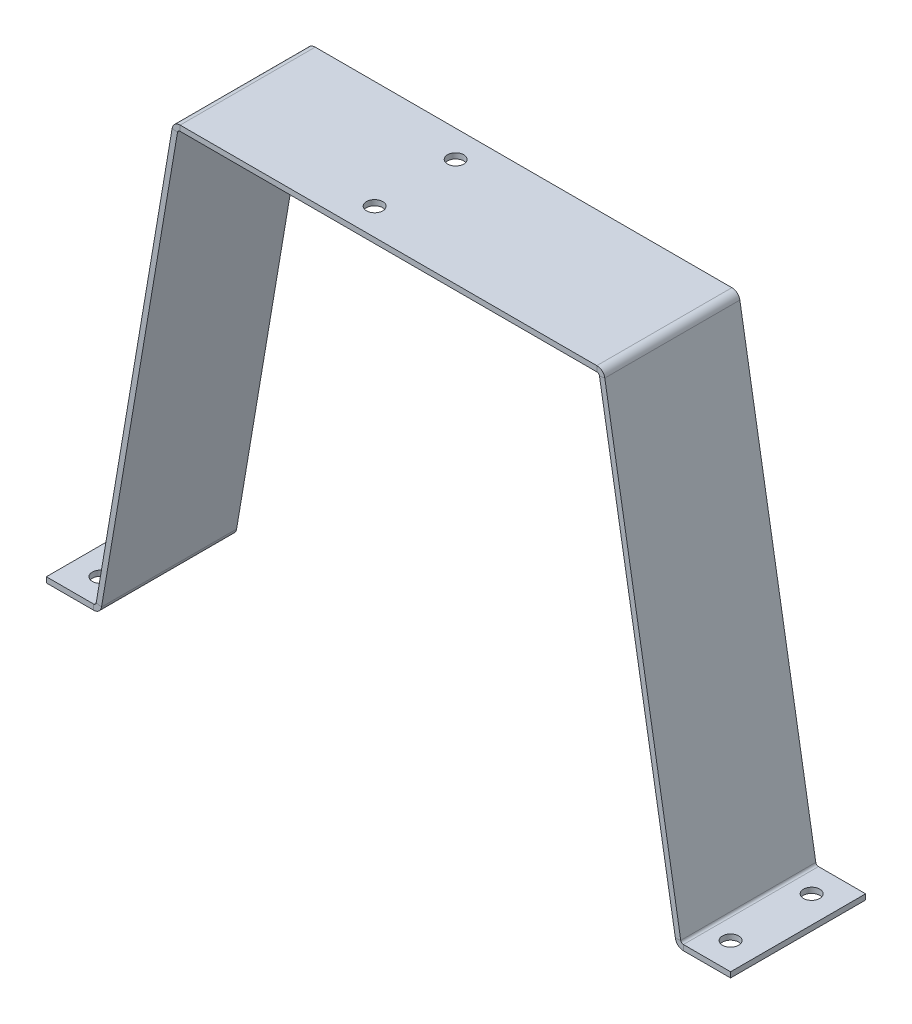
from build123d import *

# Parameters (mm, degrees)
SKETCH_1_W               = 80
SKETCH_1_H               = 25
EXTRUDE_1_DEPTH          = 1
SM_START                 = -12.5
SM_EDGE_FLANGE_1_DEPTH   = 25
SM_EDGE_FLANGE_1_2_DEPTH = 25
SM_EDGE_FLANGE_2_DEPTH   = 25
SM_EDGE_FLANGE_2_2_DEPTH = 25
SKETCH_18_R              = 1.5
CUT_EXTRUDE_1_DEPTH      = 1
SKETCH_19_R              = 1.5
CUT_EXTRUDE_2_DEPTH      = 1


# Read off the part's stored shape, not the designer's step: Ребро-кромка1, Ребро-кромка2
with BuildPart() as part:
    # Sketch 1 → Бобышка-Вытянуть1 (new body)
    with BuildSketch(Plane(origin=(0, 0, 0), x_dir=(1, 0, 0), z_dir=(0, 1, 0))):
        Rectangle(SKETCH_1_W, SKETCH_1_H)
    extrude(amount=EXTRUDE_1_DEPTH)

    # Ребро-кромка1 outline → Ребро-кромка1 (cut)
    with BuildSketch(Plane.XY.offset(SM_START)):
        with BuildLine():
            Line((-40, 0), (-39.977477944, 0))
            ThreePointArc((-39.977477944, 0), (-39.429289785, 0.724744872), (-38.563264381, 1))
            Line((-38.563264381, 1), (-40, 1))
            Line((-40, 1), (-40, 0))
        make_face()
        with BuildLine():
            Line((40, 1), (38.563264381, 1))
            ThreePointArc((38.563264381, 1), (39.429289785, 0.724744872), (39.977477944, 0))
            Line((39.977477944, 0), (40, 0))
            Line((40, 0), (40, 1))
        make_face()
    extrude(amount=SM_EDGE_FLANGE_1_DEPTH, mode=Mode.SUBTRACT)

    # Sm Edge Flange 1 2 outline → Sm Edge Flange 1 2 (add)
    with BuildSketch(Plane.XY.offset(SM_START)):
        with BuildLine():
            ThreePointArc((-39.977477944, 0), (-40.015252138, -0.123527486), (-40.042258437, -0.24984688))
            Line((-40.042258437, -0.24984688), (-54.339743625, -84.781655225))
            Line((-54.339743625, -84.781655225), (-53.353747587, -84.948423972))
            Line((-53.353747587, -84.948423972), (-39.0562624, -0.416615627))
            ThreePointArc((-39.0562624, -0.416615627), (-38.885993225, -0.118101986), (-38.563264381, 0))
            Line((-38.563264381, 0), (-39.977477944, 0))
        make_face()
        with BuildLine():
            Line((39.977477944, 0), (38.563264381, 0))
            ThreePointArc((38.563264381, 0), (38.885993225, -0.118101986), (39.0562624, -0.416615627))
            Line((39.0562624, -0.416615627), (53.353747587, -84.948423972))
            Line((53.353747587, -84.948423972), (54.339743625, -84.781655225))
            Line((54.339743625, -84.781655225), (40.042258437, -0.24984688))
            ThreePointArc((40.042258437, -0.24984688), (40.015252138, -0.123527486), (39.977477944, 0))
        make_face()
    extrude(amount=SM_EDGE_FLANGE_1_2_DEPTH)

    # Ребро-кромка2 outline → Ребро-кромка2 (cut)
    with BuildSketch(Plane.XY.offset(SM_START)):
        with BuildLine():
            Line((54.339743625, -84.781655225), (54.33598765, -84.759448567))
            ThreePointArc((54.33598765, -84.759448567), (53.529971426, -84.339802009), (53.114144989, -83.531808345))
            Line((53.114144989, -83.531808345), (53.353747587, -84.948423972))
            Line((53.353747587, -84.948423972), (54.339743625, -84.781655225))
        make_face()
        with BuildLine():
            ThreePointArc((-53.114144989, -83.531808345), (-53.529971426, -84.339802009), (-54.33598765, -84.759448567))
            Line((-54.33598765, -84.759448567), (-54.339743625, -84.781655225))
            Line((-54.339743625, -84.781655225), (-53.353747587, -84.948423972))
            Line((-53.353747587, -84.948423972), (-53.114144989, -83.531808345))
        make_face()
    extrude(amount=SM_EDGE_FLANGE_2_DEPTH, mode=Mode.SUBTRACT)

    # Sm Edge Flange 2 2 outline → Sm Edge Flange 2 2 (add)
    with BuildSketch(Plane.XY.offset(SM_START)):
        with BuildLine():
            ThreePointArc((54.33598765, -84.759448567), (54.464084816, -84.776093249), (54.593139045, -84.781655225))
            Line((54.593139045, -84.781655225), (63.325540765, -84.781655225))
            Line((63.325540765, -84.781655225), (63.325540765, -83.781655225))
            Line((63.325540765, -83.781655225), (54.593139045, -83.781655225))
            ThreePointArc((54.593139045, -83.781655225), (54.270410201, -83.663553239), (54.100141026, -83.365039598))
            Line((54.100141026, -83.365039598), (54.33598765, -84.759448567))
        make_face()
        with BuildLine():
            Line((-63.325540765, -83.781655225), (-63.325540765, -84.781655225))
            Line((-63.325540765, -84.781655225), (-54.593139045, -84.781655225))
            ThreePointArc((-54.593139045, -84.781655225), (-54.464084816, -84.776093249), (-54.33598765, -84.759448567))
            Line((-54.33598765, -84.759448567), (-54.100141026, -83.365039598))
            ThreePointArc((-54.100141026, -83.365039598), (-54.270410201, -83.663553239), (-54.593139045, -83.781655225))
            Line((-54.593139045, -83.781655225), (-63.325540765, -83.781655225))
        make_face()
    extrude(amount=SM_EDGE_FLANGE_2_2_DEPTH)

    # Эскиз18 → Вырез-Вытянуть1 (cut)
    with BuildSketch(Plane(origin=(0, 1, 0), x_dir=(1, 0, 0), z_dir=(0, 1, 0))):
        with Locations(Location((-7.563264381, 7.5, 0), (0, 0, 270))):
            Circle(SKETCH_18_R)
        with Locations(Location((-7.563264381, -7.5, 0), (0, 0, 90))):
            Circle(SKETCH_18_R)
    extrude(amount=-CUT_EXTRUDE_1_DEPTH, mode=Mode.SUBTRACT)

    # Эскиз19 → Вырез-Вытянуть2 (cut)
    with BuildSketch(Plane(origin=(0, -83.781655225, 0), x_dir=(1, 0, 0), z_dir=(0, 1, 0))):
        with Locations(Location((58.325540765, 7.5, 0), (0, 0, 270))):
            Circle(SKETCH_19_R)
        with Locations(Location((58.325540765, -7.5, 0), (0, 0, 90))):
            Circle(SKETCH_19_R)
        with Locations(Location((-58.325540765, -7.5, 0), (0, 0, 270))):
            Circle(SKETCH_19_R)
        with Locations(Location((-58.325540765, 7.5, 0), (0, 0, 90))):
            Circle(SKETCH_19_R)
    extrude(amount=-CUT_EXTRUDE_2_DEPTH, mode=Mode.SUBTRACT)


solid = part.part
